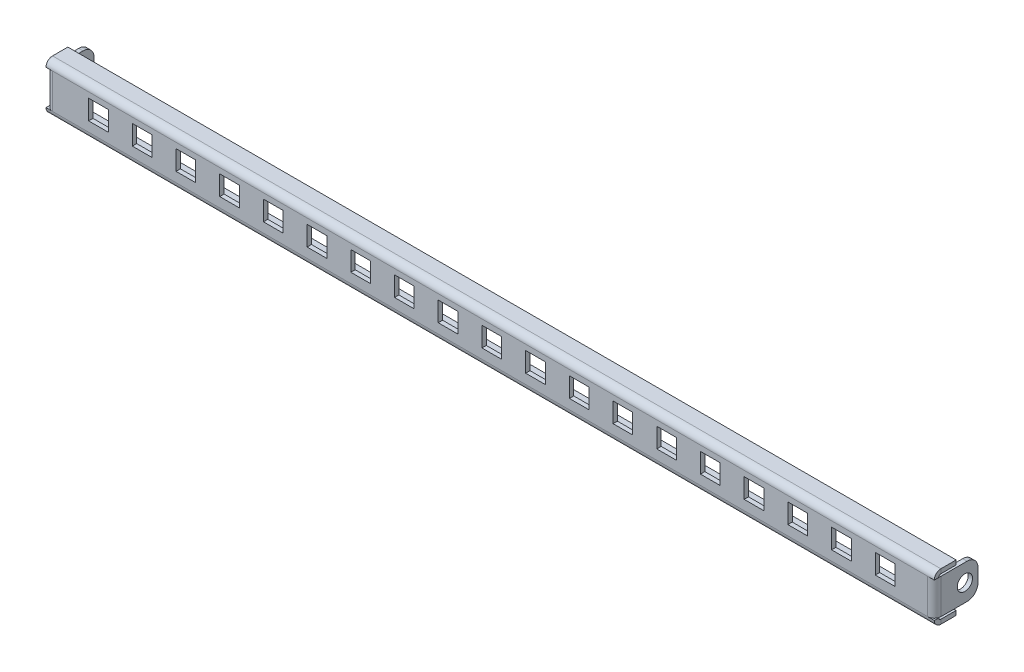
from build123d import *

# Parameters (mm, degrees)
SKETCH_1_W                         = 406.5
SKETCH_1_H                         = 22
SM_BASE_FLANGE_1_DEPTH             = 2
SM_EDGE_FLANGE_1_STRIP_W           = 10
SM_EDGE_FLANGE_1_STRIP_H           = 2
SM_EDGE_FLANGE_1_STRIP_CUT_DEPTH   = 406.5
SM_EDGE_FLANGE_1_STRIP_2_W         = 10
SM_EDGE_FLANGE_1_STRIP_2_H         = 2
SM_EDGE_FLANGE_1_STRIP_CUT_2_DEPTH = 406.5
SM_EDGE_FLANGE_1_DEPTH             = 406.5
SM_EDGE_FLANGE_1_BEND_DEPTH        = 406.5
SM_EDGE_FLANGE_2_STRIP_W           = 10
SM_EDGE_FLANGE_2_STRIP_H           = 2
SM_EDGE_FLANGE_2_STRIP_CUT_DEPTH   = 16
SM_EDGE_FLANGE_2_STRIP_2_W         = 10
SM_EDGE_FLANGE_2_STRIP_2_H         = 2
SM_EDGE_FLANGE_2_STRIP_CUT_2_DEPTH = 16
SM_EDGE_FLANGE_2_DEPTH             = 16
SM_EDGE_FLANGE_2_BEND_DEPTH        = 16
SKETCH_18_W                        = 9
SKETCH_18_H                        = 9
CUT_EXTRUDE_1_DEPTH                = 10
PATTERN_LINEAR_1_COUNT             = 19
PATTERN_LINEAR_1_PITCH             = 20
FILLET_1_R                         = 5
SKETCH_19_R                        = 3.5
CUT_EXTRUDE_2_DEPTH                = 408.140332072


# Sheet-metal steps are written as plain solids
with BuildPart() as part:
    # Sketch 1 → 基体-法兰1 (new body)
    with BuildSketch(Plane.XY):
        Rectangle(SKETCH_1_W, SKETCH_1_H)
    extrude(amount=-SM_BASE_FLANGE_1_DEPTH)

    # 边线-法兰1 strip (across the edge) → 边线-法兰1 strip cut (cut)
    with BuildSketch(Plane(origin=(203.25, -11, -2), x_dir=(0, 1, 0), z_dir=(-1, 0, 0))):
        with Locations((-2, -1)):
            Rectangle(SM_EDGE_FLANGE_1_STRIP_W, SM_EDGE_FLANGE_1_STRIP_H)
    extrude(amount=SM_EDGE_FLANGE_1_STRIP_CUT_DEPTH, mode=Mode.SUBTRACT)

    # 边线-法兰1 strip 2 (across the edge) → 边线-法兰1 strip cut 2 (cut)
    with BuildSketch(Plane(origin=(-203.25, 11, -2), x_dir=(0, -1, 0), z_dir=(1, 0, 0))):
        with Locations((-2, -1)):
            Rectangle(SM_EDGE_FLANGE_1_STRIP_2_W, SM_EDGE_FLANGE_1_STRIP_2_H)
    extrude(amount=SM_EDGE_FLANGE_1_STRIP_CUT_2_DEPTH, mode=Mode.SUBTRACT)

    # 边线-法兰1 section (across the edge) → 边线-法兰1 (add)
    with BuildSketch(Plane(origin=(203.25, -11, -2), x_dir=(0, 1, 0), z_dir=(-1, 0, 0))):
        with BuildLine():
            Line((0, 1), (0, 8))
            Line((0, 8), (2, 8))
            Line((2, 8), (2, 1))
            ThreePointArc((2, 1), (2.292893219, 0.292893219), (3, 0))
            Line((3, 0), (3, -2))
            ThreePointArc((3, -2), (0.878679656, -1.121320344), (0, 1))
        make_face()
    extrude(amount=SM_EDGE_FLANGE_1_DEPTH)

    # 边线-法兰1 section 2 (across the edge) → 边线-法兰1 bend (add)
    with BuildSketch(Plane(origin=(-203.25, 11, -2), x_dir=(0, -1, 0), z_dir=(1, 0, 0))):
        with BuildLine():
            Line((0, 1), (0, 8))
            Line((0, 8), (2, 8))
            Line((2, 8), (2, 1))
            ThreePointArc((2, 1), (2.292893219, 0.292893219), (3, 0))
            Line((3, 0), (3, -2))
            ThreePointArc((3, -2), (0.878679656, -1.121320344), (0, 1))
        make_face()
    extrude(amount=SM_EDGE_FLANGE_1_BEND_DEPTH)

    # 边线-法兰2 strip (across the edge) → 边线-法兰2 strip cut (cut)
    with BuildSketch(Plane(origin=(-203.25, -8, -2), x_dir=(1, 0, 0), z_dir=(0, 1, 0))):
        with Locations((-2, -1)):
            Rectangle(SM_EDGE_FLANGE_2_STRIP_W, SM_EDGE_FLANGE_2_STRIP_H)
    extrude(amount=SM_EDGE_FLANGE_2_STRIP_CUT_DEPTH, mode=Mode.SUBTRACT)

    # 边线-法兰2 strip 2 (across the edge) → 边线-法兰2 strip cut 2 (cut)
    with BuildSketch(Plane(origin=(203.25, 8, -2), x_dir=(-1, 0, 0), z_dir=(0, -1, 0))):
        with Locations((-2, -1)):
            Rectangle(SM_EDGE_FLANGE_2_STRIP_2_W, SM_EDGE_FLANGE_2_STRIP_2_H)
    extrude(amount=SM_EDGE_FLANGE_2_STRIP_CUT_2_DEPTH, mode=Mode.SUBTRACT)

    # 边线-法兰2 section (across the edge) → 边线-法兰2 (add)
    with BuildSketch(Plane(origin=(-203.25, -8, -2), x_dir=(1, 0, 0), z_dir=(0, 1, 0))):
        with BuildLine():
            Line((0, 1), (0, 18))
            Line((0, 18), (2, 18))
            Line((2, 18), (2, 1))
            ThreePointArc((2, 1), (2.292893219, 0.292893219), (3, 0))
            Line((3, 0), (3, -2))
            ThreePointArc((3, -2), (0.878679656, -1.121320344), (0, 1))
        make_face()
    extrude(amount=SM_EDGE_FLANGE_2_DEPTH)

    # 边线-法兰2 section 2 (across the edge) → 边线-法兰2 bend (add)
    with BuildSketch(Plane(origin=(203.25, 8, -2), x_dir=(-1, 0, 0), z_dir=(0, -1, 0))):
        with BuildLine():
            Line((0, 1), (0, 18))
            Line((0, 18), (2, 18))
            Line((2, 18), (2, 1))
            ThreePointArc((2, 1), (2.292893219, 0.292893219), (3, 0))
            Line((3, 0), (3, -2))
            ThreePointArc((3, -2), (0.878679656, -1.121320344), (0, 1))
        make_face()
    extrude(amount=SM_EDGE_FLANGE_2_BEND_DEPTH)

    # 草图18 → 切除-拉伸1 (cut)
    with BuildSketch(Plane.XY):
        with Locations((-179.25, 1)):
            Rectangle(SKETCH_18_W, SKETCH_18_H)
    cut_extrude_1 = extrude(amount=-CUT_EXTRUDE_1_DEPTH, mode=Mode.SUBTRACT)

    # 阵列(线性)1: 切除-拉伸1 ×19
    with Locations(*[(i * PATTERN_LINEAR_1_PITCH, 0, 0) for i in range(1, PATTERN_LINEAR_1_COUNT)]):
        add(cut_extrude_1, mode=Mode.SUBTRACT)

    # 圆角1
    fillet_1_edges = [part.edges().sort_by_distance(p)[0] for p in [
        (-202.25, -8, -20),
        (-202.25, 8, -20),
        (202.25, 8, -20),
        (202.25, -8, -20),
    ]]
    fillet(fillet_1_edges, radius=FILLET_1_R)

    # 草图19 → 切除-拉伸2 (cut, through all)
    with BuildSketch(Plane(origin=(203.25, 0, 0), x_dir=(0, 0, -1), z_dir=(1, 0, 0))):
        with Locations((14, 0)):
            Circle(SKETCH_19_R)
    extrude(amount=-CUT_EXTRUDE_2_DEPTH, mode=Mode.SUBTRACT)


solid = part.part
